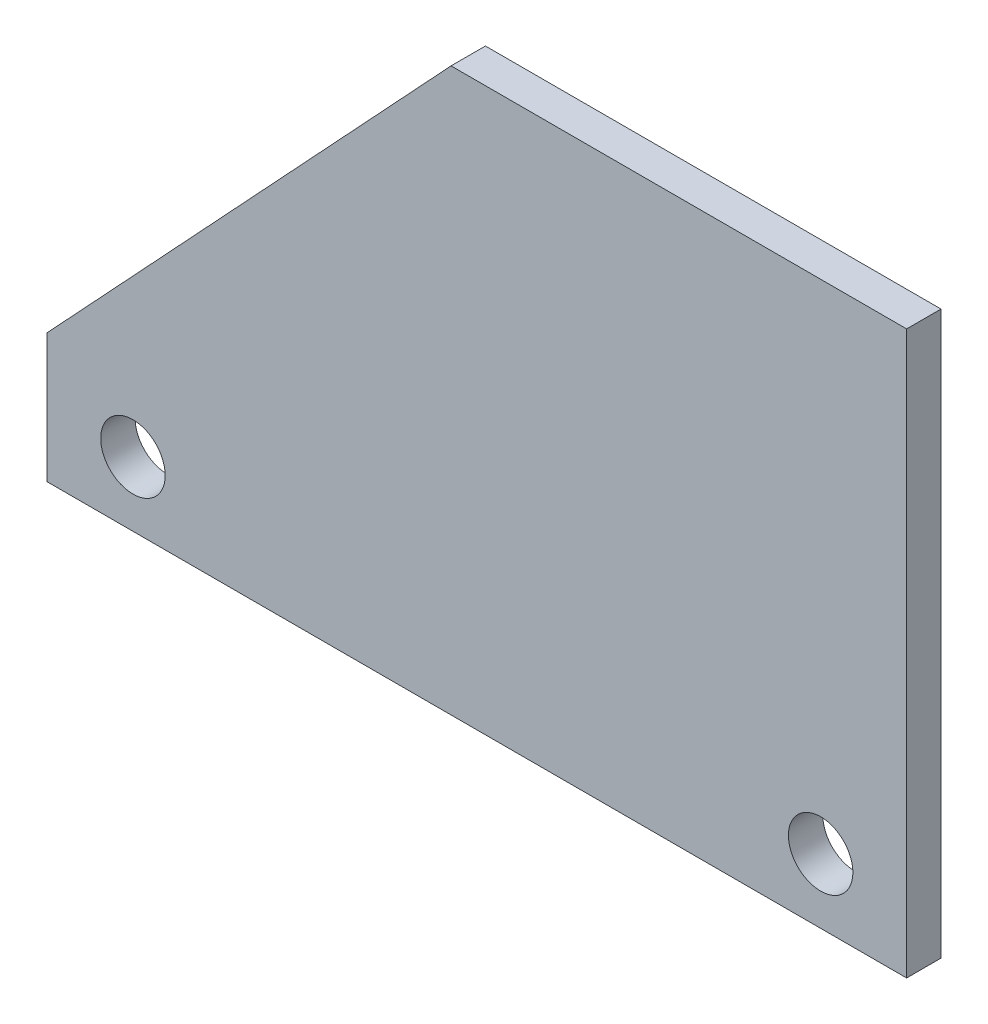
from build123d import *

# Parameters (mm, degrees)
SKETCH1_R           = 2.38125
BOSS_EXTRUDE1_DEPTH = 2.54


with BuildPart() as part:
    # Sketch1 → Boss-Extrude1 (new body)
    with BuildSketch(Plane.XY):
        Polygon((-6.35, 9.525), (23.496082005, 41.525), (57.15, 41.525), (57.15, 0), (44.45, 0), (6.35, 0), (-6.35, 0), align=None)
        with Locations((0, 4.7625)):
            Circle(SKETCH1_R, mode=Mode.SUBTRACT)
        with Locations((50.8, 4.7625)):
            Circle(SKETCH1_R, mode=Mode.SUBTRACT)
    extrude(amount=BOSS_EXTRUDE1_DEPTH)


solid = part.part
